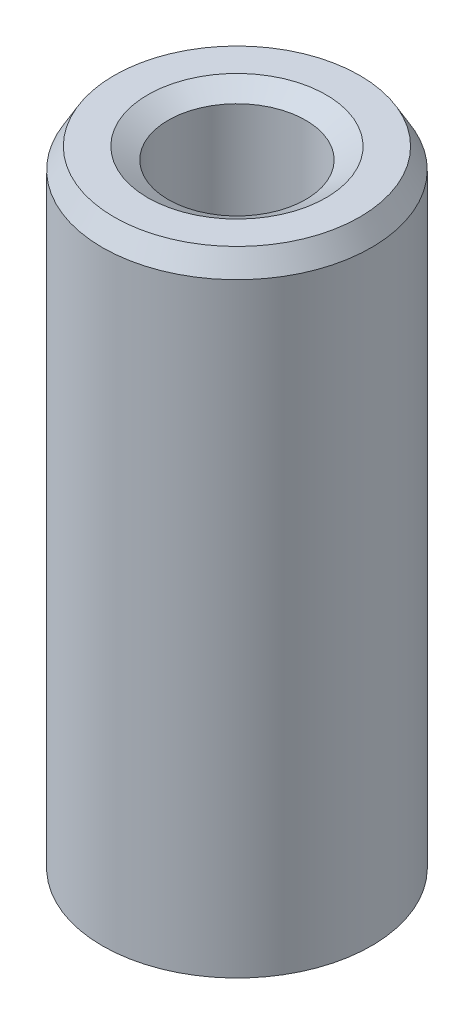
from build123d import *
from OCP.BRepFilletAPI import BRepFilletAPI_MakeChamfer

# Parameters (mm, degrees)
SKETCH1_R           = 7.5
BOSS_EXTRUDE1_DEPTH = 35.500091791
SKETCH2_R           = 3.83191164
CUT_EXTRUDE1_DEPTH  = 38.050728969
CHAMFER1_SIZE       = 1.139279532
CHAMFER1_SIZE2      = 0.657763345


with BuildPart() as part:
    # Sketch1 → Boss-Extrude1 (new body)
    with BuildSketch(Plane(origin=(0, 0, 0), x_dir=(1, 0, 0), z_dir=(0, 1, 0))):
        Circle(SKETCH1_R)
    extrude(amount=BOSS_EXTRUDE1_DEPTH)

    # Sketch2 → Cut-Extrude1 (cut, through all)
    with BuildSketch(Plane(origin=(0, 0, 0), x_dir=(1, 0, 0), z_dir=(0, 1, 0))):
        Circle(SKETCH2_R)
    extrude(amount=CUT_EXTRUDE1_DEPTH, mode=Mode.SUBTRACT)

    # Chamfer1: one chamfer whose edges measure the first distance from different faces: ONE call of the kernel's chamfer builder (chamfer() names one face for all edges)
    chamfer1_edges_1 = [part.edges().sort_by_distance(p)[0] for p in [
        (-3.83191164, 35.500091791, 0),
    ]]
    chamfer1_side_1 = [part.faces().sort_by_distance(p)[0] for p in [
        (-7.287867966, 35.500091791, 0),
    ]]
    chamfer1_edges_2 = [part.edges().sort_by_distance(p)[0] for p in [
        (-3.83191164, 0, 0),
    ]]
    chamfer1_side_2 = [part.faces().sort_by_distance(p)[0] for p in [
        (-3.83191164, 17.750045895, 0),
    ]]
    chamfer1_edges_3 = [part.edges().sort_by_distance(p)[0] for p in [
        (-7.5, 0, 0),
    ]]
    chamfer1_side_3 = [part.faces().sort_by_distance(p)[0] for p in [
        (-7.287867966, 0, 0),
    ]]
    chamfer1_edges_4 = [part.edges().sort_by_distance(p)[0] for p in [
        (-7.5, 35.500091791, 0),
    ]]
    chamfer1_side_4 = [part.faces().sort_by_distance(p)[0] for p in [
        (-7.5, 17.750045895, 0),
    ]]
    chamfer1 = BRepFilletAPI_MakeChamfer(part.part.solid().wrapped)
    for e in chamfer1_edges_1:
        chamfer1.Add(CHAMFER1_SIZE, CHAMFER1_SIZE2, e.wrapped, chamfer1_side_1[0].wrapped)  # the first distance lies on this face
    for e in chamfer1_edges_2:
        chamfer1.Add(CHAMFER1_SIZE, CHAMFER1_SIZE2, e.wrapped, chamfer1_side_2[0].wrapped)  # the first distance lies on this face
    for e in chamfer1_edges_3:
        chamfer1.Add(CHAMFER1_SIZE, CHAMFER1_SIZE2, e.wrapped, chamfer1_side_3[0].wrapped)  # the first distance lies on this face
    for e in chamfer1_edges_4:
        chamfer1.Add(CHAMFER1_SIZE, CHAMFER1_SIZE2, e.wrapped, chamfer1_side_4[0].wrapped)  # the first distance lies on this face
    add(Compound.cast(chamfer1.Shape()), mode=Mode.REPLACE)


solid = part.part
